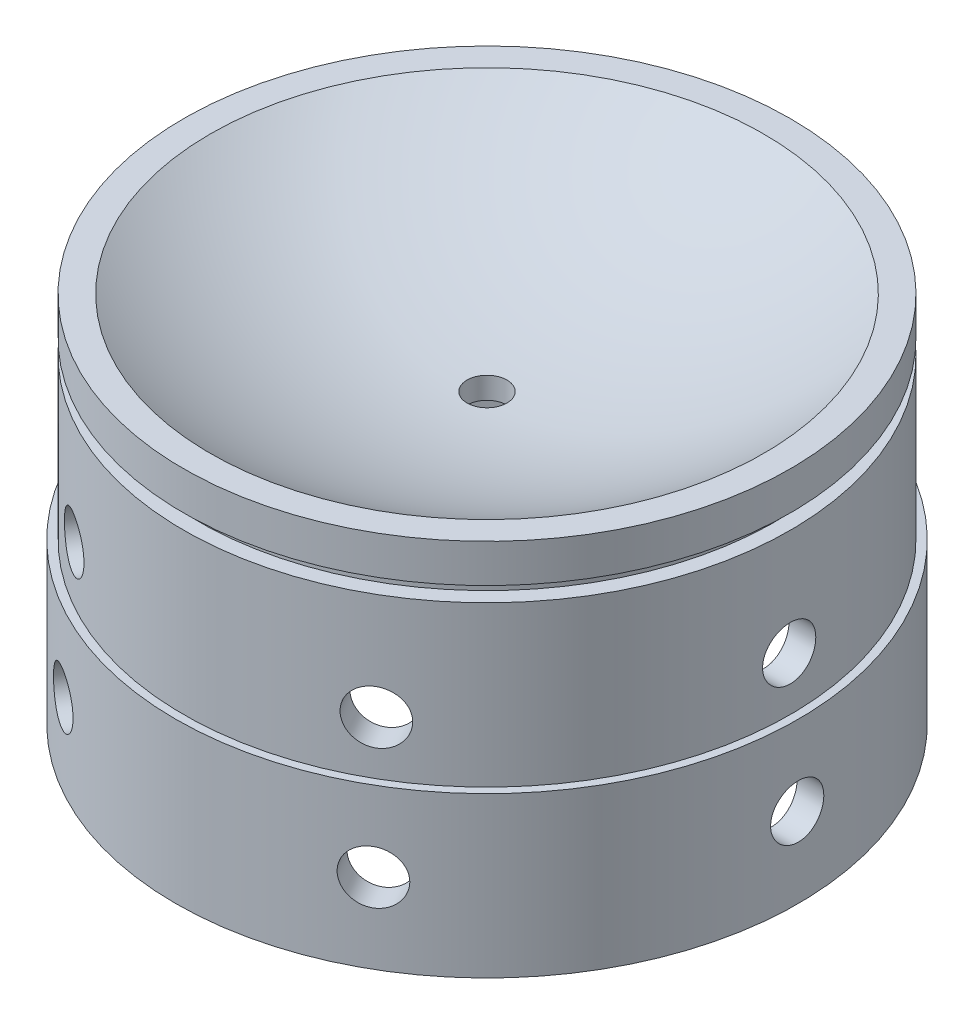
from build123d import *

# Parameters (mm, degrees)
MAIN_LINE_HOLE_REACH      = 124.767
MAIN_LINE_HOLE_END_RADIUS = 117.475
SKETCH10_R                = 4.7625
CHAMFER1_SIZE             = 2.54
SCALE1_SCALE              = 0.5
CIRPATTERN1_COUNT         = 6


with BuildPart() as part:
    # Sketch1 → Revolve1 (revolve)
    with BuildSketch(Plane.XY, mode=Mode.PRIVATE) as revolve1_sk:
        with BuildLine():
            Line((0, 5.08), (0, 0))
            Line((0, 0), (66.04, 0))
            Line((66.04, 0), (72.39, 0))
            Line((72.39, 0), (72.39, 12.7))
            Line((72.39, 12.7), (68.834, 12.7))
            Line((68.834, 12.7), (68.834, 16.256))
            Line((68.834, 16.256), (72.39, 16.256))
            Line((72.39, 16.256), (72.39, 25.4))
            Line((72.39, 25.4), (66.04, 25.4))
            ThreePointArc((66.04, 25.4), (34.547735092, 10.27486095), (0, 5.08))
        make_face()
        Polygon((72.39, 0), (66.04, 0), (66.04, -25.4), (67.945, -25.4), (72.39, -25.4), align=None)
        Polygon((74.295, -25.4), (72.39, -25.4), (67.945, -25.4), (67.945, -63.5), (74.295, -63.5), align=None)
    revolve(revolve1_sk.sketch.rotate(Axis((0, 0, 0), (0, 1, 0)), 90), axis=Axis((0, 0, 0), (0, 1, 0)))

    # Main Line Hole: up to this sphere (the profile starts outside it)
    main_line_hole_end = Location((0, 122.555, 0)) * Sphere(MAIN_LINE_HOLE_END_RADIUS, mode=Mode.PRIVATE)
    # Sketch10 → Main Line Hole (cut, up to the surface)
    with BuildSketch(Plane.XZ, mode=Mode.PRIVATE) as main_line_hole_sk1:
        with Locations(Location((0, 0, 0), (0, 0, 270))):
            Circle(SKETCH10_R)
    main_line_hole_tool1 = extrude(main_line_hole_sk1.sketch, amount=-MAIN_LINE_HOLE_REACH, mode=Mode.PRIVATE) - main_line_hole_end
    add(main_line_hole_tool1.solids().sort_by_distance((0, 0, 0))[0], mode=Mode.SUBTRACT)

    # Chamfer1
    # the kernel refuses this chamfer: 2.54 mm, written as the material it adds along each edge
    with BuildSketch(Plane(origin=(0, -25.4, 0), x_dir=(0, 0, -1), z_dir=(1, 0, 0))) as chamfer1_piece_1_section:
        Polygon((67.945 - CHAMFER1_SIZE, 0), (67.945, -CHAMFER1_SIZE), (67.945, 0), align=None)
    chamfer1_piece_1 = revolve(axis=Axis((0, -25.4, 0), (0, 1, 0)), mode=Mode.PRIVATE)
    chamfer1_piece_1 = chamfer1_piece_1 - Plane(origin=(0, -26.944579126, 0), x_dir=(0, 0, -1), z_dir=(0, -1, 0)) * Cylinder(66.04, 272, mode=Mode.PRIVATE)
    add(chamfer1_piece_1)


with BuildPart() as part_1:
    # Scale1: scaled about (0, -7.054817183, 0)
    add(part.part.scale(SCALE1_SCALE).moved(Location((0, -3.527408591, 0))))

    # Sketch9 → 1/4 (0.25) Diameter Hole1 (revolve, cut)
    with BuildSketch(Plane(origin=(37.1475, -25.752408592, 0), x_dir=(0, 0, -1), z_dir=(0, 1, 0))):
        Polygon((0, 0), (0, 39.054232465), (3.175, 37.1465), (3.175, 0), align=None)
    f_1_4_0_25_diameter_hole1 = revolve(axis=Axis((43.4975, -25.752408592, 0), (-1, 0, 0)), mode=Mode.SUBTRACT)

    # Sketch8 → 1/4 (0.25) Diameter Hole2 (revolve, cut)
    with BuildSketch(Plane(origin=(36.195, -9.877408592, 0), x_dir=(0, 0, -1), z_dir=(0, 1, 0))):
        Polygon((0, 0), (0, 38.101732465), (3.175, 36.194), (3.175, 0), align=None)
    f_1_4_0_25_diameter_hole2 = revolve(axis=Axis((42.545, -9.877408592, 0), (-1, 0, 0)), mode=Mode.SUBTRACT)

    # CirPattern1: 1/4 (0.25) Diameter Hole1, 1/4 (0.25) Diameter Hole2 ×6 about axis
    cirpattern1_axis = Axis((0, -16.227408592, 0), (0, -1, 0))
    add([f_1_4_0_25_diameter_hole1.rotate(cirpattern1_axis, i * 360 / CIRPATTERN1_COUNT) for i in range(1, CIRPATTERN1_COUNT)], mode=Mode.SUBTRACT)
    add([f_1_4_0_25_diameter_hole2.rotate(cirpattern1_axis, i * 360 / CIRPATTERN1_COUNT) for i in range(1, CIRPATTERN1_COUNT)], mode=Mode.SUBTRACT)


solid = part_1.part
